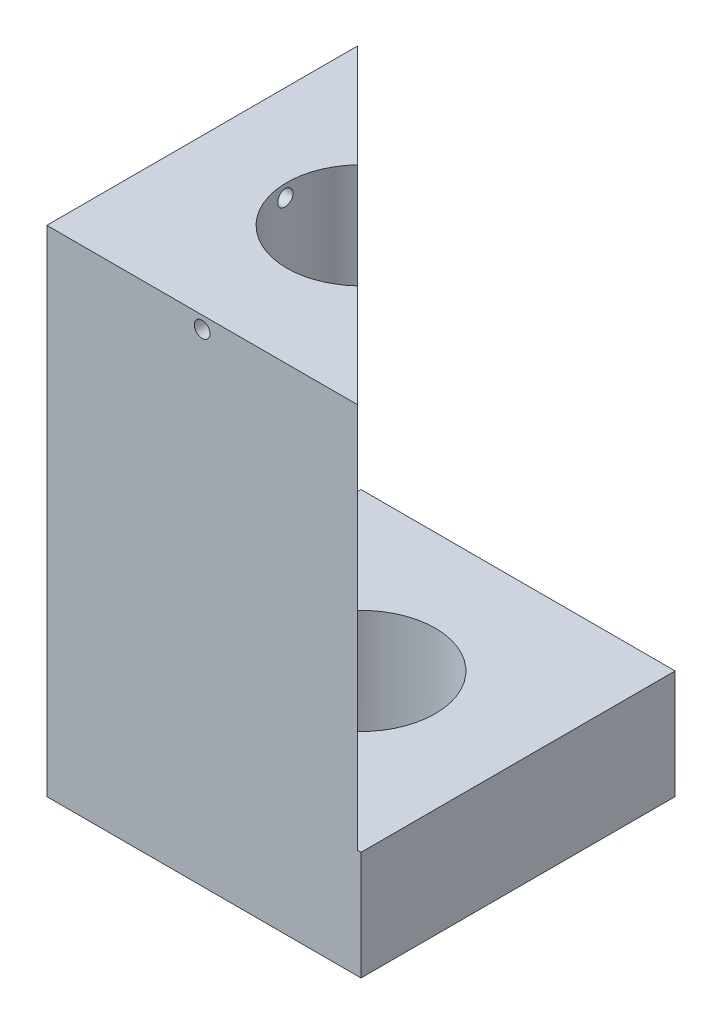
from build123d import *

# Parameters (mm, degrees)
SKETCH1_W                             = 12.7
SKETCH1_H                             = 12.7
BOSS_EXTRUDE1_DEPTH                   = 20
SKETCH2_R                             = 3
CUT_EXTRUDE1_DEPTH                    = 27.880848201
CUT_EXTRUDE2_DEPTH                    = 15.6
F_72_0_025_DIAMETER_HOLE1_D           = 0.635
F_72_0_025_DIAMETER_HOLE1_ON_FACE_2_D = 0.635


with BuildPart() as part:
    # Sketch1 → Boss-Extrude1 (new body)
    with BuildSketch(Plane(origin=(0, 0, 0), x_dir=(1, 0, 0), z_dir=(0, 1, 0))):
        with Locations((6.35, 6.35)):
            Rectangle(SKETCH1_W, SKETCH1_H)
    extrude(amount=BOSS_EXTRUDE1_DEPTH)

    # Sketch2 → Cut-Extrude1 (cut, through all)
    with BuildSketch(Plane(origin=(0, 20, 0), x_dir=(1, 0, 0), z_dir=(0, 1, 0))):
        with Locations((6.35, 6.35)):
            Circle(SKETCH2_R)
    extrude(amount=-CUT_EXTRUDE1_DEPTH, mode=Mode.SUBTRACT)

    # Sketch3 → Cut-Extrude2 (cut)
    with BuildSketch(Plane(origin=(0, 20, 0), x_dir=(1, 0, 0), z_dir=(0, 1, 0))):
        Polygon((12.7, 0), (12.556315902, 0), (0, 12.556315902), (0, 12.7), (12.7, 12.7), align=None)
    extrude(amount=-CUT_EXTRUDE2_DEPTH, mode=Mode.SUBTRACT)

    # #72 (0.025) Diameter Hole1 (through all)
    with Locations(Plane(origin=(6.278157951, 19.5, 0), x_dir=(1, 0, 0), z_dir=(0, 0, 1))):
        with Locations((0, 0)):
            Hole(F_72_0_025_DIAMETER_HOLE1_D / 2)

    # #72 (0.025) Diameter Hole1 on face 2 (through all)
    with Locations(Plane(origin=(0, 19.5, -6.278157951), x_dir=(0, 0, -1), z_dir=(-1, 0, 0))):
        with Locations((0, 0)):
            Hole(F_72_0_025_DIAMETER_HOLE1_ON_FACE_2_D / 2)


solid = part.part
